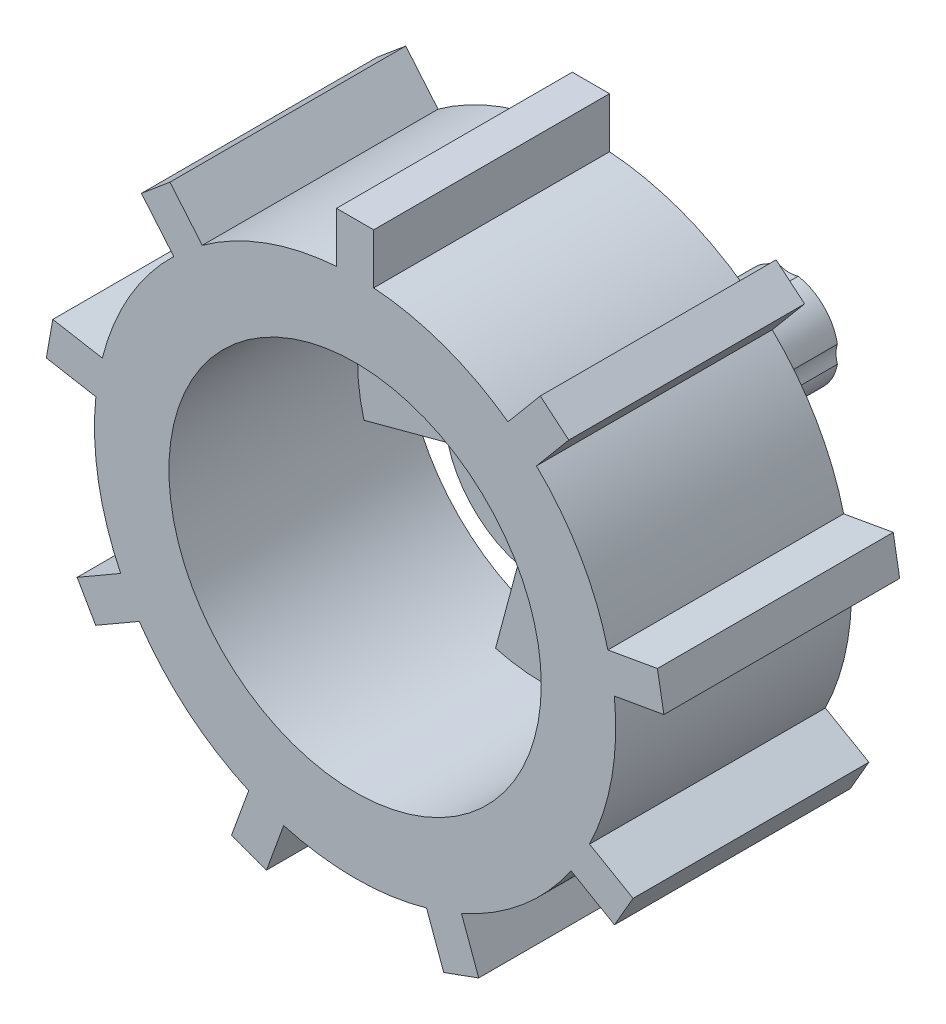
from build123d import *

# Parameters (mm, degrees)
SKIZZE1_R                       = 6
AUFSATZ_LINEAR_AUSTRAGEN1_DEPTH = 9
SKIZZE2_R                       = 3.925
AUFSATZ_LINEAR_AUSTRAGEN2_DEPTH = 7
SKIZZE3_R                       = 21
AUFSATZ_LINEAR_AUSTRAGEN3_DEPTH = 19
SKIZZE4_R                       = 15
SCHNITT_LINEAR_AUSTRAGEN2_DEPTH = 15.2
AUFSATZ_LINEAR_START            = -19
AUFSATZ_LINEAR_AUSTRAGEN4_DEPTH = 19
KREISMUSTER1_COUNT              = 9
SKETCH1_R                       = 1.5
CUT_EXTRUDE1_DEPTH              = 41.448579025
CUT_EXTRUDE2_START              = -3.8
SKETCH2_R                       = 2.25
CUT_EXTRUDE2_DEPTH              = 37.648579025
CUT_EXTRUDE3_START              = -3.8
CUT_EXTRUDE3_DEPTH              = 3.8


# Read off the part's stored shape, not the designer's step: Cut-Extrude3
with BuildPart() as part:
    # Skizze1 → Aufsatz-Linear austragen1 (new body)
    with BuildSketch(Plane.XY):
        Circle(SKIZZE1_R)
    extrude(amount=AUFSATZ_LINEAR_AUSTRAGEN1_DEPTH)

    # Skizze2 → Aufsatz-Linear austragen2 (add)
    with BuildSketch(Plane(origin=(0, 0, 0), x_dir=(-1, 0, 0), z_dir=(0, 0, -1))):
        Circle(SKIZZE2_R)
    extrude(amount=AUFSATZ_LINEAR_AUSTRAGEN2_DEPTH)

    # Skizze3 → Aufsatz-Linear austragen3 (add)
    with BuildSketch(Plane.XY.offset(9)):
        Circle(SKIZZE3_R)
    extrude(amount=AUFSATZ_LINEAR_AUSTRAGEN3_DEPTH)

    # Skizze4 → Schnitt-Linear austragen2 (cut)
    with BuildSketch(Plane.XY.offset(28)):
        Circle(SKIZZE4_R)
    extrude(amount=-SCHNITT_LINEAR_AUSTRAGEN2_DEPTH, mode=Mode.SUBTRACT)

    # Skizze6 → Aufsatz-Linear austragen4 (add)
    with BuildSketch(Plane.XY.offset(28).offset(AUFSATZ_LINEAR_START)):
        with BuildLine():
            Line((1.5, 25), (-1.5, 25))
            Line((-1.5, 25), (-1.5, 20.946360066))
            ThreePointArc((-1.5, 20.946360066), (0, 21), (1.5, 20.946360066))
            Line((1.5, 20.946360066), (1.5, 25))
        make_face()
    aufsatz_linear_austragen4 = extrude(amount=AUFSATZ_LINEAR_AUSTRAGEN4_DEPTH)

    # Kreismuster1: Aufsatz-Linear austragen4 ×9 about axis
    kreismuster1_axis = Axis((0, 0, 0), (0, 0, 1))
    for i in range(1, KREISMUSTER1_COUNT):
        add(aufsatz_linear_austragen4.rotate(kreismuster1_axis, i * 360 / KREISMUSTER1_COUNT))

    # Sketch1 → Cut-Extrude1 (cut, through all)
    with BuildSketch(Plane.XY.offset(12.8)):
        with Locations((-6, 0)):
            Circle(SKETCH1_R)
        with Locations((0, 6)):
            Circle(SKETCH1_R)
        with Locations((6, 0)):
            Circle(SKETCH1_R)
        with Locations((0, -6)):
            Circle(SKETCH1_R)
    extrude(amount=-CUT_EXTRUDE1_DEPTH, mode=Mode.SUBTRACT)

    # Sketch2 → Cut-Extrude2 (cut, through all)
    with BuildSketch(Plane.XY.offset(12.8).offset(CUT_EXTRUDE2_START)):
        with Locations((0, 6)):
            Circle(SKETCH2_R)
        with Locations((6, 0)):
            Circle(SKETCH2_R)
        with Locations((0, -6)):
            Circle(SKETCH2_R)
        with Locations((-6, 0)):
            Circle(SKETCH2_R)
    extrude(amount=-CUT_EXTRUDE2_DEPTH, mode=Mode.SUBTRACT)

    # Cut-Extrude3 outline → Cut-Extrude3 (cut)
    with BuildSketch(Plane(origin=(0, 0, 9), x_dir=(-1, 0, 0), z_dir=(0, 0, -1)).offset(CUT_EXTRUDE3_START)):
        with BuildLine():
            Line((7.72740661, 2.070552361), (14.488887394, 3.882285677))
            ThreePointArc((14.488887394, 3.882285677), (10.606601718, 10.606601718), (3.882285677, 14.488887394))
            Line((3.882285677, 14.488887394), (2.070552361, 7.72740661))
            ThreePointArc((2.070552361, 7.72740661), (5.656854249, 5.656854249), (7.72740661, 2.070552361))
        make_face()
        with BuildLine():
            ThreePointArc((3.882285677, -14.488887394), (10.606601718, -10.606601718), (14.488887394, -3.882285677))
            Line((14.488887394, -3.882285677), (7.72740661, -2.070552361))
            ThreePointArc((7.72740661, -2.070552361), (5.656854249, -5.656854249), (2.070552361, -7.72740661))
            Line((2.070552361, -7.72740661), (3.882285677, -14.488887394))
        make_face()
        with BuildLine():
            Line((-2.070552361, 7.72740661), (-3.882285677, 14.488887394))
            ThreePointArc((-3.882285677, 14.488887394), (-10.606601718, 10.606601718), (-14.488887394, 3.882285677))
            Line((-14.488887394, 3.882285677), (-7.72740661, 2.070552361))
            ThreePointArc((-7.72740661, 2.070552361), (-5.656854249, 5.656854249), (-2.070552361, 7.72740661))
        make_face()
        with BuildLine():
            ThreePointArc((-14.488887394, -3.882285677), (-10.606601718, -10.606601718), (-3.882285677, -14.488887394))
            Line((-3.882285677, -14.488887394), (-2.070552361, -7.72740661))
            ThreePointArc((-2.070552361, -7.72740661), (-5.656854249, -5.656854249), (-7.72740661, -2.070552361))
            Line((-7.72740661, -2.070552361), (-14.488887394, -3.882285677))
        make_face()
    extrude(amount=CUT_EXTRUDE3_DEPTH, mode=Mode.SUBTRACT)


solid = part.part
